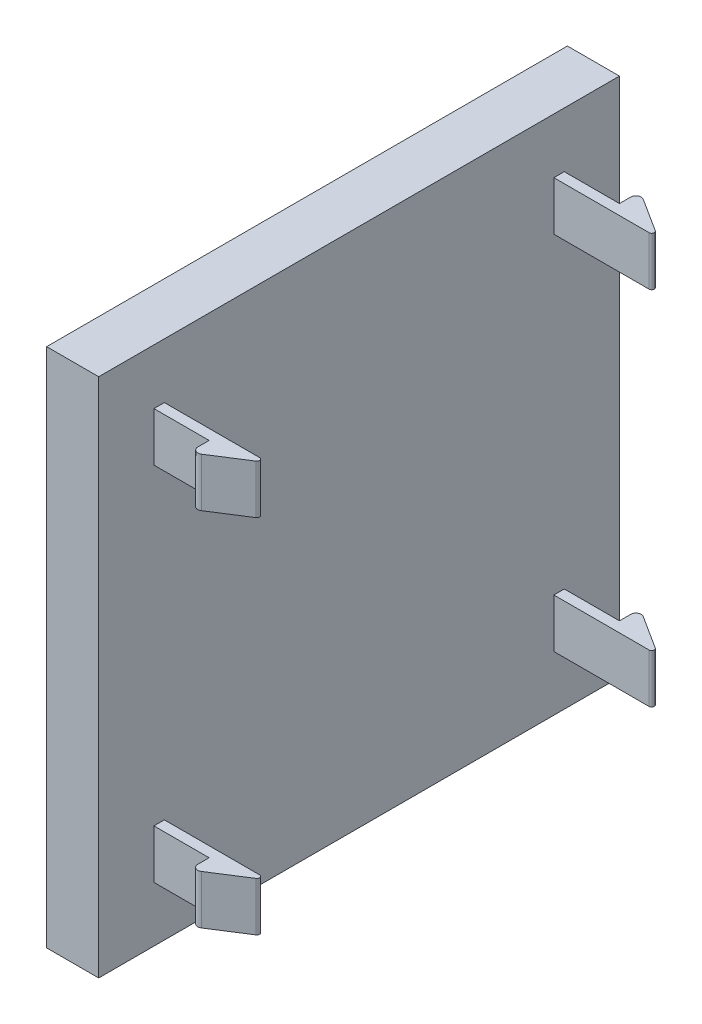
from build123d import *

# Parameters (mm, degrees)
BOSS_EXTRUDE2_DEPTH = 50
SKETCH17_W          = 50
SKETCH17_H          = 5.3
CUT_EXTRUDE5_DEPTH  = 72.414284285
FILLET2_R           = 0.5
SKETCH18_W          = 15
SKETCH18_H          = 15
BOSS_EXTRUDE3_DEPTH = 15
SKETCH20_R          = 2.5
CUT_EXTRUDE6_DEPTH  = 4.9
SKETCH27_R          = 2.5
CUT_EXTRUDE11_DEPTH = 4.9
SKETCH30_R          = 2.5
CUT_EXTRUDE12_DEPTH = 4.9
CHAMFER1_SIZE       = 1
FILLET3_R           = 0.5
SKETCH31_W          = 50
SKETCH31_H          = 30
CUT_EXTRUDE13_DEPTH = 74.484692283
FILLET4_R           = 0.25


with BuildPart() as part:
    # Sketch3 → Boss-Extrude2 (new body)
    with BuildSketch(Plane(origin=(0, 0, 0), x_dir=(1, 0, 0), z_dir=(0, 1, 0))):
        Polygon((5, 44.7), (10.3, 44.7), (10.3, 46.7), (15, 43.7), (5, 43.7), (5, 6.3), (15, 6.3), (10.3, 3.3), (10.3, 5.3), (5, 5.3), (5, 0), (0, 0), (0, 50), (5, 50), align=None)
    extrude(amount=BOSS_EXTRUDE2_DEPTH)

    # Sketch17 → Cut-Extrude5 (cut, through all)
    with BuildSketch(Plane(origin=(5, 0, 0), x_dir=(0, 0, -1), z_dir=(1, 0, 0))):
        with Locations((25, 2.65)):
            Rectangle(SKETCH17_W, SKETCH17_H)
        with Locations((25, 47.35)):
            Rectangle(SKETCH17_W, SKETCH17_H)
    extrude(amount=CUT_EXTRUDE5_DEPTH, mode=Mode.SUBTRACT)

    # Fillet2
    fillet2_edges = [part.edges().sort_by_distance(p)[0] for p in [
        (10.3, 25, -46.7),
        (10.3, 25, -3.3),
    ]]
    fillet(fillet2_edges, radius=FILLET2_R)

    # Sketch18 → Boss-Extrude3 (add)
    with BuildSketch(Plane.ZY):
        with Locations((-25, 25)):
            Rectangle(SKETCH18_W, SKETCH18_H)
    extrude(amount=BOSS_EXTRUDE3_DEPTH)

    # Sketch20 → Cut-Extrude6 (cut)
    with BuildSketch(Plane(origin=(0, 32.5, 0), x_dir=(1, 0, 0), z_dir=(0, 1, 0))):
        with Locations((-7.5, 25)):
            Circle(SKETCH20_R)
    extrude(amount=-CUT_EXTRUDE6_DEPTH, mode=Mode.SUBTRACT)

    # Sketch27 → Cut-Extrude11 (cut)
    with BuildSketch(Plane.XY.offset(-17.5)):
        with Locations((-7.5, 25)):
            Circle(SKETCH27_R)
    extrude(amount=-CUT_EXTRUDE11_DEPTH, mode=Mode.SUBTRACT)

    # Sketch30 → Cut-Extrude12 (cut)
    with BuildSketch(Plane.ZY.offset(15)):
        with Locations((-25, 25)):
            Circle(SKETCH30_R)
    extrude(amount=-CUT_EXTRUDE12_DEPTH, mode=Mode.SUBTRACT)

    # Chamfer1
    chamfer1_edges = [part.edges().sort_by_distance(p)[0] for p in [
        (-7.5, 17.5, -17.5),
        (-15, 17.5, -25),
        (-7.5, 17.5, -32.5),
        (-7.5, 32.5, -32.5),
        (-15, 25, -32.5),
        (-15, 32.5, -25),
        (-15, 25, -17.5),
        (-7.5, 32.5, -17.5),
    ]]
    chamfer(chamfer1_edges, length=CHAMFER1_SIZE)

    # Fillet3
    fillet3_edges = [part.edges().sort_by_distance(p)[0] for p in [
        (-10, 32.5, -25),
        (-15, 25, -27.5),
        (-10, 25, -17.5),
    ]]
    fillet(fillet3_edges, radius=FILLET3_R)

    # Sketch31 → Cut-Extrude13 (cut, through all)
    with BuildSketch(Plane(origin=(5, 0, 0), x_dir=(0, 0, -1), z_dir=(1, 0, 0))):
        with Locations((25, 25)):
            Rectangle(SKETCH31_W, SKETCH31_H)
    extrude(amount=CUT_EXTRUDE13_DEPTH, mode=Mode.SUBTRACT)

    # Fillet4
    fillet4_edges = [part.edges().sort_by_distance(p)[0] for p in [
        (15, 42.35, -43.7),
        (15, 7.65, -43.7),
        (15, 7.65, -6.3),
        (15, 42.35, -6.3),
    ]]
    fillet(fillet4_edges, radius=FILLET4_R)


solid = part.part
